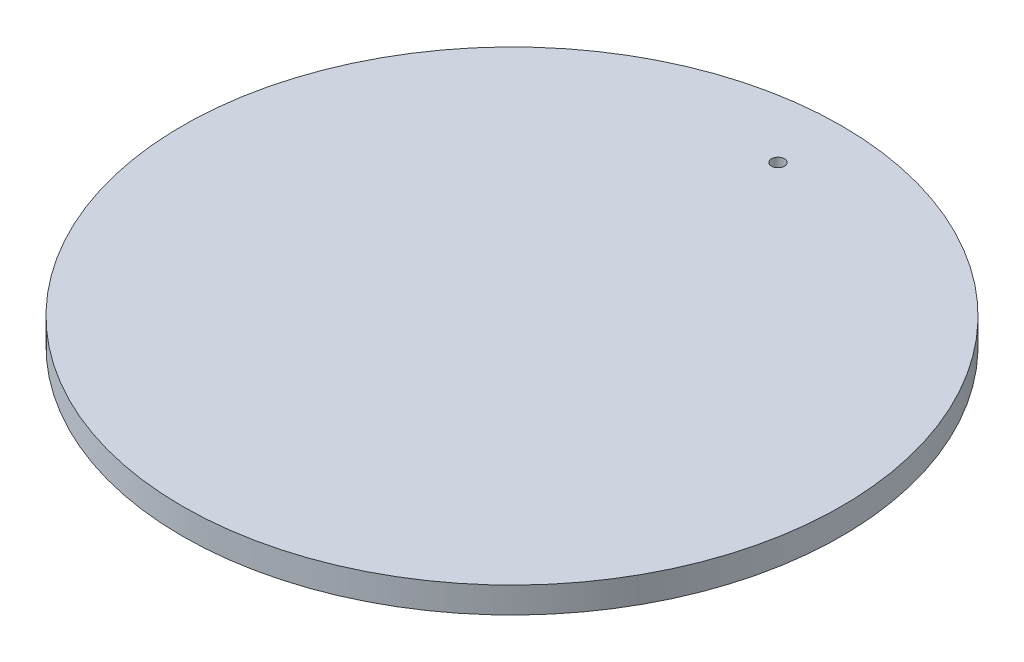
from build123d import *

# Parameters (mm, degrees)
SKETCH1_R               = 12.7
BOSS_EXTRUDE1_DEPTH     = 1
CUT_EXTRUDE3_DEPTH      = 18.98832955
CUT_EXTRUDE3_DEPTH_BACK = 18.98832955
SKETCH4_R               = 0.25


with BuildPart() as part:
    # Sketch1 → Boss-Extrude1 (new body)
    with BuildSketch(Plane(origin=(0, 0, 0), x_dir=(1, 0, 0), z_dir=(0, 1, 0))):
        Circle(SKETCH1_R)
    extrude(amount=BOSS_EXTRUDE1_DEPTH)

    # Sketch4 → Cut-Extrude3 (cut, two sides: drawn at the far end of the back side and taken through both)
    with BuildSketch(Plane(origin=(0, 1, 0), x_dir=(1, 0, 0), z_dir=(0, 1, 0)).offset(-CUT_EXTRUDE3_DEPTH_BACK)):
        with Locations((0, 10.25)):
            Circle(SKETCH4_R)
    extrude(amount=CUT_EXTRUDE3_DEPTH + CUT_EXTRUDE3_DEPTH_BACK, mode=Mode.SUBTRACT)


solid = part.part
